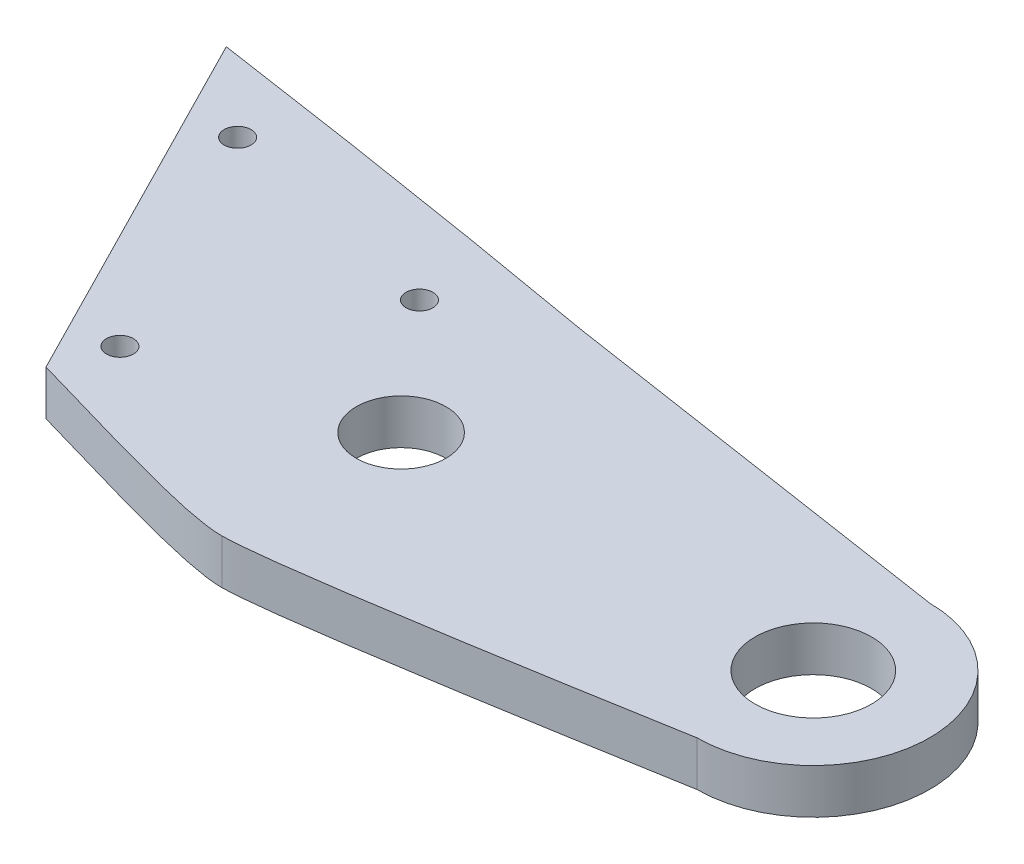
from build123d import *

# Parameters (mm, degrees)
BOSS_EXTRUDE1_DEPTH      = 20
BOSS_EXTRUDE1_DEPTH_BACK = 20
SKETCH1_R                = 5
SKETCH1_R_2              = 6.5
CUT_EXTRUDE4_DEPTH       = 35
SKETCH6_R                = 1.5
CUT_EXTRUDE5_DEPTH       = 10
CUT_EXTRUDE6_DEPTH       = 50


with BuildPart() as part:
    # Sketch1 → Boss-Extrude1 (new, two sides: drawn at the far end of the back side and taken through both)
    with BuildSketch(Plane(origin=(0, 0, 0), x_dir=(1, 0, 0), z_dir=(0, 1, 0)).offset(-BOSS_EXTRUDE1_DEPTH_BACK)):
        with BuildLine():
            ThreePointArc((-328.284271247, 28.284271247), (-328.284271247, -28.284271247), (-271.715728753, -28.284271247))
            add(Edge.make_bspline(
                [(-271.715728753, -28.284271247), (-189.219937614, 54.211519891), (-20, -20), (3.938998468, -20), (19.272331802, -17.666666667), (46, -13)],
                knots=[0, 0, 0, 0, 1, 1, 1.196949923, 1.196949923, 1.196949923, 1.196949923], degree=3))
            ThreePointArc((46, -13), (59, 0), (46, 13))
            add(Edge.make_bspline(
                [(46, 13), (0.03150303, 20), (0, 20)],
                knots=[0.358766717, 0.358766717, 0.358766717, 1.358766717, 1.358766717, 1.358766717], degree=2))
            add(Edge.make_bspline(
                [(0, 20), (-114.873131821, 40.378289836), (-300, 56.568542495), (-328.284271247, 28.284271247)],
                knots=[0.1900067, 0.1900067, 0.1900067, 0.1900067, 1.1900067, 1.1900067, 1.1900067, 1.1900067], degree=3))
        make_face()
        Circle(SKETCH1_R, mode=Mode.SUBTRACT)
        with Locations((46, 0)):
            Circle(SKETCH1_R_2, mode=Mode.SUBTRACT)
    extrude(amount=BOSS_EXTRUDE1_DEPTH + BOSS_EXTRUDE1_DEPTH_BACK)

    # Sketch5 → Cut-Extrude4 (cut)
    with BuildSketch(Plane(origin=(0, 20, 0), x_dir=(1, 0, 0), z_dir=(0, 1, 0))):
        Polygon((-47.037049996, 27.527548523), (92.120786702, 16.164640032), (85.724700256, -16.918764701), (-17.262768022, -30.907770073), align=None)
    extrude(amount=-CUT_EXTRUDE4_DEPTH, mode=Mode.SUBTRACT)

    # Sketch6 → Cut-Extrude5 (cut)
    with BuildSketch(Plane(origin=(0, -20, 0), x_dir=(-1, 0, 0), z_dir=(0, -1, 0))):
        with Locations((24.014889595, -7.36188607)):
            Circle(SKETCH6_R)
        with Locations((11.774348541, 13.823097503)):
            Circle(SKETCH6_R)
        with Locations((37.652809151, 19.404038123)):
            Circle(SKETCH6_R)
    extrude(amount=-CUT_EXTRUDE5_DEPTH, mode=Mode.SUBTRACT)

    # Sketch7 → Cut-Extrude6 (cut)
    with BuildSketch(Plane(origin=(0, 20, 0), x_dir=(1, 0, 0), z_dir=(0, 1, 0))):
        Polygon((-47.037049996, 27.527548523), (-26.137658318, -13.489817144), (-379.595719096, -92.580220424), (-321.505561991, 137.254748988), align=None)
    extrude(amount=-CUT_EXTRUDE6_DEPTH, mode=Mode.SUBTRACT)


solid = part.part
